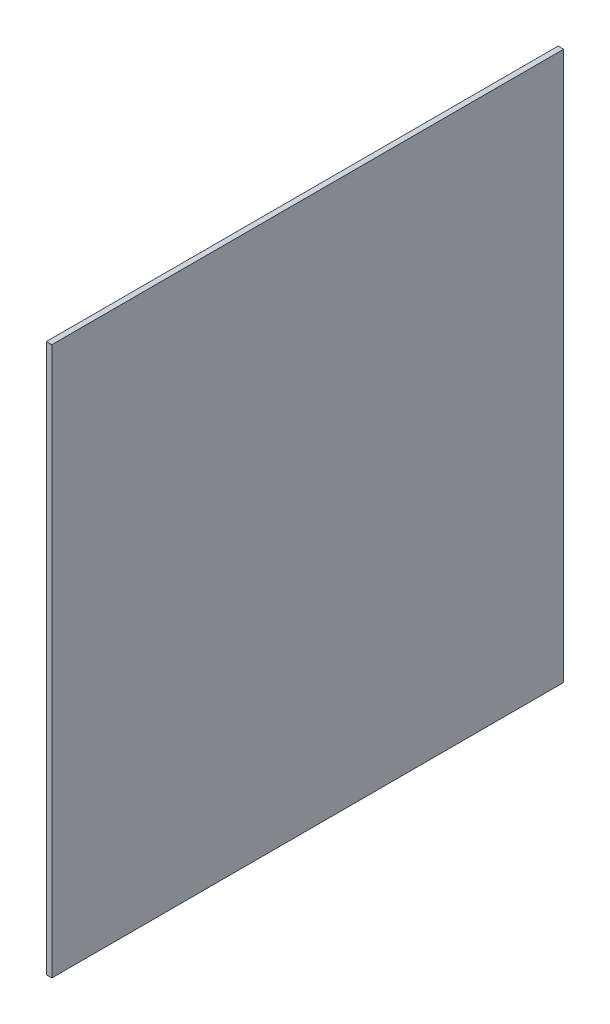
from build123d import *

# Parameters (mm, degrees)
SKETCH1_W           = 280
SKETCH1_H           = 300
BOSS_EXTRUDE2_DEPTH = 3


with BuildPart() as part:
    # Sketch1 → Boss-Extrude2 (new body)
    with BuildSketch(Plane(origin=(0, 0, 0), x_dir=(0, 0, -1), z_dir=(1, 0, 0))):
        with Locations((-128.14516129, -133.935483871)):
            Rectangle(SKETCH1_W, SKETCH1_H)
    extrude(amount=BOSS_EXTRUDE2_DEPTH)


solid = part.part
